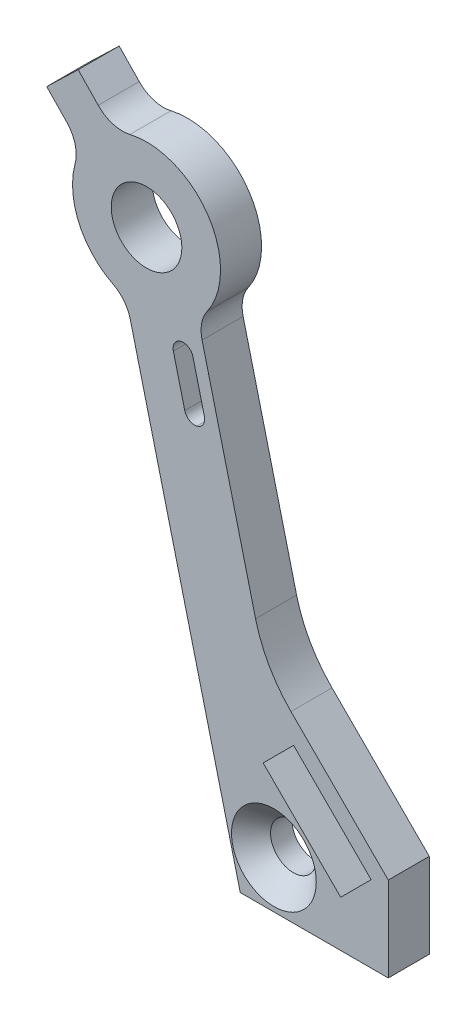
from build123d import *

# Parameters (mm, degrees)
SKETCH1_R           = 1.5
SKETCH1_R_2         = 2.625
BOSS_EXTRUDE1_DEPTH = 3.05
FILLET3_R           = 2.5
FILLET4_R           = 10
FILLET6_R           = 0.75


with BuildPart() as part:
    # Sketch1 → Boss-Extrude1 (new body)
    with BuildSketch(Plane.XY):
        with BuildLine():
            Line((-8.481662584, 34.046021185), (0, 0))
            Line((0, 0), (11, 0))
            Line((11, 0), (11, 6.303908615))
            Line((11, 6.303908615), (1.807611845, 15.496296771))
            Line((1.807611845, 15.496296771), (-3.144779945, 35.375563851))
            ThreePointArc((-3.144779945, 35.375563851), (-2.481245275, 42.518446356), (-9.444822751, 44.241709966))
            Line((-9.444822751, 44.241709966), (-12.046172881, 46.936525265))
            Line((-12.046172881, 46.936525265), (-14.384461968, 44.67933583))
            Line((-14.384461968, 44.67933583), (-11.783111838, 41.984520531))
            ThreePointArc((-11.783111838, 41.984520531), (-12.042982397, 37.220695866), (-8.481662584, 34.046021185))
        make_face()
        with Locations((2.5, 3.5)):
            Circle(SKETCH1_R, mode=Mode.SUBTRACT)
        Polygon((9.727207794, 5.692209589), (7.517499103, 3.482500897), (7.464466094, 3.429467889), (1.701545827, 9.192388155), (3.964287527, 11.455129855), align=None, mode=Mode.SUBTRACT)
        Polygon((-3.942100566, 28.234165792), (-5.150775718, 33.085877281), (-3.695262271, 33.448479827), (-2.48658712, 28.596768337), align=None, mode=Mode.SUBTRACT)
        with Locations((-6.964638989, 39.33266846)):
            Circle(SKETCH1_R_2, mode=Mode.SUBTRACT)
    extrude(amount=BOSS_EXTRUDE1_DEPTH)

    # Sketch3 → CSK for M3 Flat Head Machine Screw1 (revolve, cut)
    with BuildSketch(Plane(origin=(2.5, 3.5, 3.05), x_dir=(0, -1, 0), z_dir=(1, 0, 0))):
        Polygon((0, 0), (0, 3.05), (1.7, 3.05), (1.7, 1.45), (3.15, 0), align=None)
    revolve(axis=Axis((2.5, 3.5, 9.4), (0, 0, -1)), mode=Mode.SUBTRACT)

    # Fillet3
    fillet3_edges = [part.edges().sort_by_distance(p)[0] for p in [
        (-3.144779945, 35.375563851, 1.525),
        (-8.481662584, 34.046021185, 1.525),
        (-11.783111838, 41.984520531, 1.525),
        (-9.444822751, 44.241709966, 1.525),
    ]]
    fillet(fillet3_edges, radius=FILLET3_R)

    # Fillet4
    fillet4_edges = [part.edges().sort_by_distance(p)[0] for p in [
        (1.807611845, 15.496296771, 1.525),
    ]]
    fillet(fillet4_edges, radius=FILLET4_R)

    # Fillet6
    fillet6_edges = [part.edges().sort_by_distance(p)[0] for p in [
        (-2.48658712, 28.596768337, 1.525),
        (-3.942100566, 28.234165792, 1.525),
        (-3.695262271, 33.448479827, 1.525),
        (-5.150775718, 33.085877281, 1.525),
    ]]
    fillet(fillet6_edges, radius=FILLET6_R - 0.0001)  # a hair under: the kernel refuses the full size


solid = part.part
